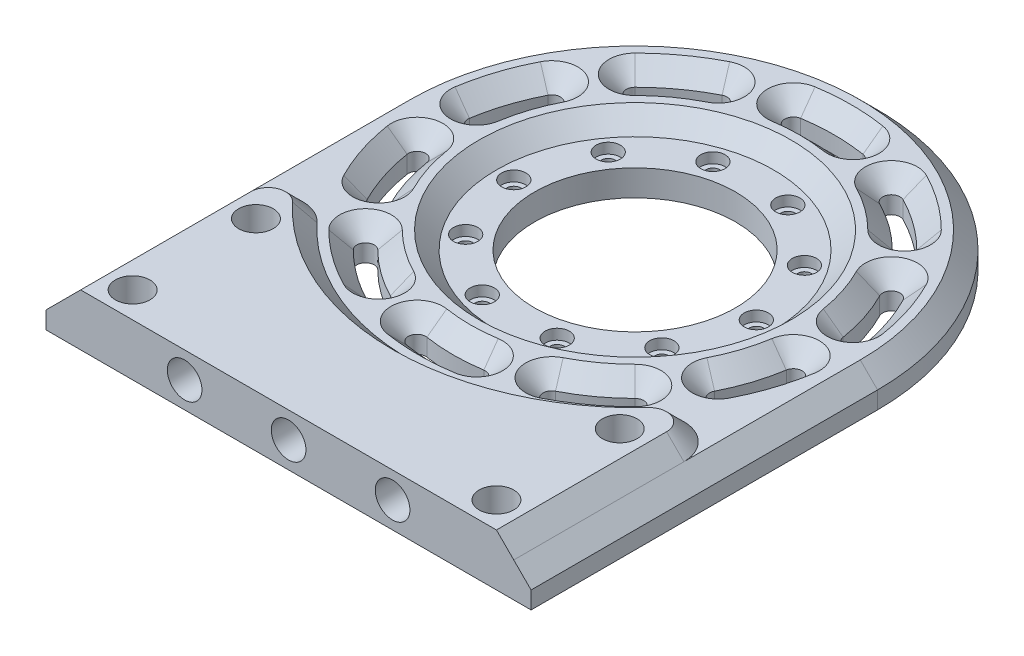
from build123d import *

# Parameters (mm, degrees)
SKETCH1_R           = 2
SKETCH1_R_2         = 29
BOSS_EXTRUDE2_DEPTH = 10
CUT_EXTRUDE5_START  = -5
SKETCH4_R           = 40
SKETCH4_R_2         = 29
CUT_EXTRUDE5_DEPTH  = 5
CHAMFER11_SIZE      = 5
CUT_EXTRUDE8_DEPTH  = 10
CHAMFER16_SIZE      = 5
BOSS_EXTRUDE3_DEPTH = 5
CUT_EXTRUDE9_DEPTH  = 10
CHAMFER18_SIZE      = 5
SKETCH12_R          = 3.5
CUT_EXTRUDE12_DEPTH = 3
BOSS_EXTRUDE4_START = 2.5
SKETCH13_R          = 45
SKETCH13_R_2        = 2
SKETCH13_R_3        = 29
BOSS_EXTRUDE4_DEPTH = 2.5
SKETCH14_R          = 5
CUT_EXTRUDE13_DEPTH = 10


with BuildPart() as part:
    # Sketch1 → Boss-Extrude2 (new body)
    with BuildSketch(Plane(origin=(0, 0, 0), x_dir=(1, 0, 0), z_dir=(0, 1, 0))):
        with BuildLine():
            Line((70, -100), (70, 0))
            ThreePointArc((70, 0), (0, 70), (-70, 0))
            Line((-70, 0), (-70, -100))
            Line((-70, -100), (70, -100))
        make_face()
        with Locations(Location((-28.315594803, 20.57248383, 0), (0, 0, 270))):
            Circle(SKETCH1_R, mode=Mode.SUBTRACT)
        with Locations(Location((-10.815594803, 33.28697807, 0), (0, 0, 270))):
            Circle(SKETCH1_R, mode=Mode.SUBTRACT)
        with Locations(Location((10.815594803, 33.28697807, 0), (0, 0, 270))):
            Circle(SKETCH1_R, mode=Mode.SUBTRACT)
        with Locations(Location((28.315594803, 20.57248383, 0), (0, 0, 270))):
            Circle(SKETCH1_R, mode=Mode.SUBTRACT)
        with Locations(Location((35, 0, 0), (0, 0, 270))):
            Circle(SKETCH1_R, mode=Mode.SUBTRACT)
        with Locations(Location((28.315594803, -20.57248383, 0), (0, 0, 270))):
            Circle(SKETCH1_R, mode=Mode.SUBTRACT)
        with Locations(Location((10.815594803, -33.28697807, 0), (0, 0, 270))):
            Circle(SKETCH1_R, mode=Mode.SUBTRACT)
        with Locations(Location((-10.815594803, -33.28697807, 0), (0, 0, 270))):
            Circle(SKETCH1_R, mode=Mode.SUBTRACT)
        with Locations(Location((-28.315594803, -20.57248383, 0), (0, 0, 270))):
            Circle(SKETCH1_R, mode=Mode.SUBTRACT)
        with Locations(Location((-35, 0, 0), (0, 0, 270))):
            Circle(SKETCH1_R, mode=Mode.SUBTRACT)
        with Locations(Location((0, 0, 0), (0, 0, 270))):
            Circle(SKETCH1_R_2, mode=Mode.SUBTRACT)
    extrude(amount=BOSS_EXTRUDE2_DEPTH)

    # Sketch4 → Cut-Extrude5 (cut)
    with BuildSketch(Plane(origin=(0, 10, 0), x_dir=(1, 0, 0), z_dir=(0, 1, 0)).offset(CUT_EXTRUDE5_START)):
        with Locations(Location((0, 0, 0), (0, 0, 270))):
            Circle(SKETCH4_R)
        with Locations(Location((0, 0, 0), (0, 0, 270))):
            Circle(SKETCH4_R_2, mode=Mode.SUBTRACT)
    extrude(amount=CUT_EXTRUDE5_DEPTH, mode=Mode.SUBTRACT)

    # Chamfer11
    chamfer11_edges = [part.edges().sort_by_distance(p)[0] for p in [
        (0, 10, -40),
        (0, 10, -70),
        (-70, 10, 50),
        (70, 10, 50),
    ]]
    chamfer(chamfer11_edges, length=CHAMFER11_SIZE - 0.0001)  # a hair under: the kernel refuses the full size

    # Sketch7 → Cut-Extrude8 (cut)
    with BuildSketch(Plane(origin=(0, 10, 0), x_dir=(1, 0, 0), z_dir=(0, 1, 0))):
        with BuildLine():
            ThreePointArc((-51.232875141, 26.104453735), (-54.685749687, 17.768477177), (-56.792079584, 8.99498174))
            ThreePointArc((-56.792079584, 8.99498174), (-54.713944895, 6.134674726), (-51.853637881, 8.212809415))
            ThreePointArc((-51.853637881, 8.212809415), (-49.930467105, 16.223392205), (-46.77784252, 23.834501236))
            ThreePointArc((-46.77784252, 23.834501236), (-47.870382581, 27.196993796), (-51.232875141, 26.104453735))
        make_face()
        with BuildLine():
            ThreePointArc((-26.104453735, 51.232875141), (-33.797652007, 46.518477177), (-40.658639918, 40.658639918))
            ThreePointArc((-40.658639918, 40.658639918), (-40.658639918, 37.123106012), (-37.123106012, 37.123106012))
            ThreePointArc((-37.123106012, 37.123106012), (-30.858725745, 42.473392205), (-23.834501236, 46.77784252))
            ThreePointArc((-23.834501236, 46.77784252), (-22.741961175, 50.14033508), (-26.104453735, 51.232875141))
        make_face()
        with BuildLine():
            ThreePointArc((8.99498174, 56.792079584), (0, 57.5), (-8.99498174, 56.792079584))
            ThreePointArc((-8.99498174, 56.792079584), (-11.073116429, 53.93177257), (-8.212809415, 51.853637881))
            ThreePointArc((-8.212809415, 51.853637881), (0, 52.5), (8.212809415, 51.853637881))
            ThreePointArc((8.212809415, 51.853637881), (11.073116429, 53.93177257), (8.99498174, 56.792079584))
        make_face()
        with BuildLine():
            ThreePointArc((40.658639918, 40.658639918), (33.797652007, 46.518477177), (26.104453735, 51.232875141))
            ThreePointArc((26.104453735, 51.232875141), (22.741961175, 50.14033508), (23.834501236, 46.77784252))
            ThreePointArc((23.834501236, 46.77784252), (30.858725745, 42.473392205), (37.123106012, 37.123106012))
            ThreePointArc((37.123106012, 37.123106012), (40.658639918, 37.123106012), (40.658639918, 40.658639918))
        make_face()
        with BuildLine():
            ThreePointArc((56.792079584, 8.99498174), (54.685749687, 17.768477177), (51.232875141, 26.104453735))
            ThreePointArc((51.232875141, 26.104453735), (47.870382581, 27.196993796), (46.77784252, 23.834501236))
            ThreePointArc((46.77784252, 23.834501236), (49.930467105, 16.223392205), (51.853637881, 8.212809415))
            ThreePointArc((51.853637881, 8.212809415), (54.713944895, 6.134674726), (56.792079584, 8.99498174))
        make_face()
        with BuildLine():
            ThreePointArc((51.232875141, -26.104453735), (54.685749687, -17.768477177), (56.792079584, -8.99498174))
            ThreePointArc((56.792079584, -8.99498174), (54.713944895, -6.134674726), (51.853637881, -8.212809415))
            ThreePointArc((51.853637881, -8.212809415), (49.930467105, -16.223392205), (46.77784252, -23.834501236))
            ThreePointArc((46.77784252, -23.834501236), (47.870382581, -27.196993796), (51.232875141, -26.104453735))
        make_face()
        with BuildLine():
            ThreePointArc((26.104453735, -51.232875141), (33.797652007, -46.518477177), (40.658639918, -40.658639918))
            ThreePointArc((40.658639918, -40.658639918), (40.658639918, -37.123106012), (37.123106012, -37.123106012))
            ThreePointArc((37.123106012, -37.123106012), (30.858725745, -42.473392205), (23.834501236, -46.77784252))
            ThreePointArc((23.834501236, -46.77784252), (22.741961175, -50.14033508), (26.104453735, -51.232875141))
        make_face()
        with BuildLine():
            ThreePointArc((-8.99498174, -56.792079584), (0, -57.5), (8.99498174, -56.792079584))
            ThreePointArc((8.99498174, -56.792079584), (11.073116429, -53.93177257), (8.212809415, -51.853637881))
            ThreePointArc((8.212809415, -51.853637881), (0, -52.5), (-8.212809415, -51.853637881))
            ThreePointArc((-8.212809415, -51.853637881), (-11.073116429, -53.93177257), (-8.99498174, -56.792079584))
        make_face()
        with BuildLine():
            ThreePointArc((-40.658639918, -40.658639918), (-33.797652007, -46.518477177), (-26.104453735, -51.232875141))
            ThreePointArc((-26.104453735, -51.232875141), (-22.741961175, -50.14033508), (-23.834501236, -46.77784252))
            ThreePointArc((-23.834501236, -46.77784252), (-30.858725745, -42.473392205), (-37.123106012, -37.123106012))
            ThreePointArc((-37.123106012, -37.123106012), (-40.658639918, -37.123106012), (-40.658639918, -40.658639918))
        make_face()
        with BuildLine():
            ThreePointArc((-56.792079584, -8.99498174), (-54.685749687, -17.768477177), (-51.232875141, -26.104453735))
            ThreePointArc((-51.232875141, -26.104453735), (-47.870382581, -27.196993796), (-46.77784252, -23.834501236))
            ThreePointArc((-46.77784252, -23.834501236), (-49.930467105, -16.223392205), (-51.853637881, -8.212809415))
            ThreePointArc((-51.853637881, -8.212809415), (-54.713944895, -6.134674726), (-56.792079584, -8.99498174))
        make_face()
    extrude(amount=-CUT_EXTRUDE8_DEPTH, mode=Mode.SUBTRACT)

    # Chamfer16
    chamfer16_edges = [part.edges().sort_by_distance(p)[0] for p in [
        (-49.930467105, 10, 16.223392205),
        (-54.713944895, 10, 6.134674726),
        (-54.685749687, 10, 17.768477177),
        (-47.870382581, 10, 27.196993796),
        (-30.858725745, 10, 42.473392205),
        (-40.658639918, 10, 37.123106012),
        (-33.797652007, 10, 46.518477177),
        (-22.741961175, 10, 50.14033508),
        (0, 10, 52.5),
        (-11.073116429, 10, 53.93177257),
        (0, 10, 57.5),
        (11.073116429, 10, 53.93177257),
        (30.858725745, 10, 42.473392205),
        (22.741961175, 10, 50.14033508),
        (33.797652007, 10, 46.518477177),
        (40.658639918, 10, 37.123106012),
        (49.930467105, 10, 16.223392205),
        (47.870382581, 10, 27.196993796),
        (54.685749687, 10, 17.768477177),
        (54.713944895, 10, 6.134674726),
        (49.930467105, 10, -16.223392205),
        (54.713944895, 10, -6.134674726),
        (54.685749687, 10, -17.768477177),
        (47.870382581, 10, -27.196993796),
        (30.858725745, 10, -42.473392205),
        (40.658639918, 10, -37.123106012),
        (33.797652007, 10, -46.518477177),
        (22.741961175, 10, -50.14033508),
        (0, 10, -52.5),
        (11.073116429, 10, -53.93177257),
        (0, 10, -57.5),
        (-11.073116429, 10, -53.93177257),
        (-49.930467105, 10, -16.223392205),
        (-47.870382581, 10, -27.196993796),
        (-54.685749687, 10, -17.768477177),
        (-54.713944895, 10, -6.134674726),
        (-30.858725745, 10, -42.473392205),
        (-22.741961175, 10, -50.14033508),
        (-33.797652007, 10, -46.518477177),
        (-40.658639918, 10, -37.123106012),
    ]]
    chamfer(chamfer16_edges, length=CHAMFER16_SIZE)

    # Sketch8 → Boss-Extrude3 (add)
    with BuildSketch(Plane(origin=(0, 10, 0), x_dir=(1, 0, 0), z_dir=(0, 1, 0))):
        with BuildLine():
            Line((-60, -50.893246483), (-60, -100))
            Line((-60, -100), (60, -100))
            Line((60, -100), (60, -50.893246483))
            ThreePointArc((60, -50.893246483), (56.825741858, -46.238499801), (51.333333333, -47.49390014))
            ThreePointArc((51.333333333, -47.49390014), (0, -69.903051347), (-51.333333333, -47.49390014))
            ThreePointArc((-51.333333333, -47.49390014), (-56.825741858, -46.238499801), (-60, -50.893246483))
        make_face()
    extrude(amount=BOSS_EXTRUDE3_DEPTH)

    # Sketch9 → Cut-Extrude9 (cut)
    with BuildSketch(Plane(origin=(0, 15, 0), x_dir=(1, 0, 0), z_dir=(0, 1, 0))):
        with BuildLine():
            ThreePointArc((-52.5, -56.911822602), (-50.633684973, -58.575702097), (-48.714667694, -60.178511955))
            ThreePointArc((-48.714667694, -60.178511955), (-47.813494824, -58.654426755), (-47.5, -56.911822602))
            ThreePointArc((-47.5, -56.911822602), (-56.035533906, -53.376288696), (-52.5, -61.911822602))
            Line((-52.5, -61.911822602), (-52.5, -56.911822602))
        make_face()
        with BuildLine():
            ThreePointArc((-52.5, -61.911822602), (-50.418347623, -61.457889405), (-48.714667694, -60.178511955))
            ThreePointArc((-48.714667694, -60.178511955), (-50.633684973, -58.575702097), (-52.5, -56.911822602))
            Line((-52.5, -56.911822602), (-52.5, -61.911822602))
        make_face()
        with BuildLine():
            ThreePointArc((-52.5, -56.911822602), (-50.633684973, -58.575702097), (-48.714667694, -60.178511955))
            ThreePointArc((-48.714667694, -60.178511955), (-47.813494824, -58.654426755), (-47.5, -56.911822602))
            ThreePointArc((-47.5, -56.911822602), (-56.035533906, -53.376288696), (-52.5, -61.911822602))
            Line((-52.5, -61.911822602), (-52.5, -56.911822602))
        make_face()
        with BuildLine():
            ThreePointArc((-52.5, -61.911822602), (-50.418347623, -61.457889405), (-48.714667694, -60.178511955))
            ThreePointArc((-48.714667694, -60.178511955), (-50.633684973, -58.575702097), (-52.5, -56.911822602))
            Line((-52.5, -56.911822602), (-52.5, -61.911822602))
        make_face()
        with BuildLine():
            ThreePointArc((-52.5, -87.5), (-56.035533906, -96.035533906), (-47.5, -92.5))
            Line((-47.5, -92.5), (-52.5, -92.5))
            Line((-52.5, -92.5), (-52.5, -87.5))
        make_face()
        with BuildLine():
            Line((-52.5, -92.5), (-47.5, -92.5))
            ThreePointArc((-47.5, -92.5), (-48.964466094, -88.964466094), (-52.5, -87.5))
            Line((-52.5, -87.5), (-52.5, -92.5))
        make_face()
        with BuildLine():
            ThreePointArc((-52.5, -87.5), (-56.035533906, -96.035533906), (-47.5, -92.5))
            Line((-47.5, -92.5), (-52.5, -92.5))
            Line((-52.5, -92.5), (-52.5, -87.5))
        make_face()
        with BuildLine():
            Line((-52.5, -92.5), (-47.5, -92.5))
            ThreePointArc((-47.5, -92.5), (-48.964466094, -88.964466094), (-52.5, -87.5))
            Line((-52.5, -87.5), (-52.5, -92.5))
        make_face()
        with BuildLine():
            ThreePointArc((57.5, -92.5), (56.035533906, -88.964466094), (52.5, -87.5))
            Line((52.5, -87.5), (52.5, -92.5))
            Line((52.5, -92.5), (47.5, -92.5))
            ThreePointArc((47.5, -92.5), (52.5, -97.5), (57.5, -92.5))
        make_face()
        with BuildLine():
            Line((52.5, -92.5), (52.5, -87.5))
            ThreePointArc((52.5, -87.5), (48.964466094, -88.964466094), (47.5, -92.5))
            Line((47.5, -92.5), (52.5, -92.5))
        make_face()
        with BuildLine():
            ThreePointArc((57.5, -92.5), (56.035533906, -88.964466094), (52.5, -87.5))
            Line((52.5, -87.5), (52.5, -92.5))
            Line((52.5, -92.5), (47.5, -92.5))
            ThreePointArc((47.5, -92.5), (52.5, -97.5), (57.5, -92.5))
        make_face()
        with BuildLine():
            Line((52.5, -92.5), (52.5, -87.5))
            ThreePointArc((52.5, -87.5), (48.964466094, -88.964466094), (47.5, -92.5))
            Line((47.5, -92.5), (52.5, -92.5))
        make_face()
        with BuildLine():
            ThreePointArc((48.714667694, -60.178511955), (50.633684973, -58.575702097), (52.5, -56.911822602))
            Line((52.5, -56.911822602), (52.5, -61.911822602))
            ThreePointArc((52.5, -61.911822602), (56.035533906, -60.447356508), (57.5, -56.911822602))
            ThreePointArc((57.5, -56.911822602), (50.757395847, -52.225317426), (48.714667694, -60.178511955))
        make_face()
        with BuildLine():
            Line((52.5, -61.911822602), (52.5, -56.911822602))
            ThreePointArc((52.5, -56.911822602), (50.633684973, -58.575702097), (48.714667694, -60.178511955))
            ThreePointArc((48.714667694, -60.178511955), (50.418347623, -61.457889405), (52.5, -61.911822602))
        make_face()
        with BuildLine():
            ThreePointArc((48.714667694, -60.178511955), (50.633684973, -58.575702097), (52.5, -56.911822602))
            Line((52.5, -56.911822602), (52.5, -61.911822602))
            ThreePointArc((52.5, -61.911822602), (56.035533906, -60.447356508), (57.5, -56.911822602))
            ThreePointArc((57.5, -56.911822602), (50.757395847, -52.225317426), (48.714667694, -60.178511955))
        make_face()
        with BuildLine():
            Line((52.5, -61.911822602), (52.5, -56.911822602))
            ThreePointArc((52.5, -56.911822602), (50.633684973, -58.575702097), (48.714667694, -60.178511955))
            ThreePointArc((48.714667694, -60.178511955), (50.418347623, -61.457889405), (52.5, -61.911822602))
        make_face()
    extrude(amount=-CUT_EXTRUDE9_DEPTH, mode=Mode.SUBTRACT)

    # Chamfer18
    chamfer18_edges = [part.edges().sort_by_distance(p)[0] for p in [
        (60, 10, 75.446623241),
        (56.825741858, 10, 46.238499801),
        (0, 10, 69.903051347),
        (-56.825741858, 10, 46.238499801),
        (-60, 10, 75.446623241),
    ]]
    chamfer(chamfer18_edges, length=CHAMFER18_SIZE - 0.0001)  # a hair under: the kernel refuses the full size

    # Sketch12 → Cut-Extrude12 (cut)
    with BuildSketch(Plane(origin=(0, 5, 0), x_dir=(1, 0, 0), z_dir=(0, 1, 0))):
        with Locations(Location((-35, 0, 0), (0, 0, 270))):
            Circle(SKETCH12_R)
        with Locations(Location((-28.315594803, 20.57248383, 0), (0, 0, 270))):
            Circle(SKETCH12_R)
        with Locations(Location((-10.815594803, 33.28697807, 0), (0, 0, 270))):
            Circle(SKETCH12_R)
        with Locations(Location((10.815594803, 33.28697807, 0), (0, 0, 270))):
            Circle(SKETCH12_R)
        with Locations(Location((28.315594803, 20.57248383, 0), (0, 0, 270))):
            Circle(SKETCH12_R)
        with Locations(Location((35, 0, 0), (0, 0, 270))):
            Circle(SKETCH12_R)
        with Locations(Location((28.315594803, -20.57248383, 0), (0, 0, 270))):
            Circle(SKETCH12_R)
        with Locations(Location((10.815594803, -33.28697807, 0), (0, 0, 270))):
            Circle(SKETCH12_R)
        with Locations(Location((-10.815594803, -33.28697807, 0), (0, 0, 270))):
            Circle(SKETCH12_R)
        with Locations(Location((-28.315594803, -20.57248383, 0), (0, 0, 270))):
            Circle(SKETCH12_R)
    extrude(amount=-CUT_EXTRUDE12_DEPTH, mode=Mode.SUBTRACT)

    # Sketch13 → Boss-Extrude4 (add)
    with BuildSketch(Plane.XZ.offset(BOSS_EXTRUDE4_START)):
        with Locations(Location((0, 0, 0), (0, 0, 90))):
            Circle(SKETCH13_R)
        with Locations(Location((-10.815594803, -33.28697807, 0), (0, 0, 270))):
            Circle(SKETCH13_R_2, mode=Mode.SUBTRACT)
        with Locations(Location((-28.315594803, -20.57248383, 0), (0, 0, 270))):
            Circle(SKETCH13_R_2, mode=Mode.SUBTRACT)
        with Locations(Location((10.815594803, -33.28697807, 0), (0, 0, 270))):
            Circle(SKETCH13_R_2, mode=Mode.SUBTRACT)
        with Locations(Location((28.315594803, -20.57248383, 0), (0, 0, 270))):
            Circle(SKETCH13_R_2, mode=Mode.SUBTRACT)
        with Locations(Location((-35, 0, 0), (0, 0, 270))):
            Circle(SKETCH13_R_2, mode=Mode.SUBTRACT)
        with Locations(Location((-28.315594803, 20.57248383, 0), (0, 0, 270))):
            Circle(SKETCH13_R_2, mode=Mode.SUBTRACT)
        with Locations(Location((-10.815594803, 33.28697807, 0), (0, 0, 270))):
            Circle(SKETCH13_R_2, mode=Mode.SUBTRACT)
        with Locations(Location((0, 0, 0), (0, 0, 270))):
            Circle(SKETCH13_R_3, mode=Mode.SUBTRACT)
        with Locations(Location((35, 0, 0), (0, 0, 270))):
            Circle(SKETCH13_R_2, mode=Mode.SUBTRACT)
        with Locations(Location((28.315594803, 20.57248383, 0), (0, 0, 270))):
            Circle(SKETCH13_R_2, mode=Mode.SUBTRACT)
        with Locations(Location((10.815594803, 33.28697807, 0), (0, 0, 270))):
            Circle(SKETCH13_R_2, mode=Mode.SUBTRACT)
    extrude(amount=-BOSS_EXTRUDE4_DEPTH)

    # Sketch14 → Cut-Extrude13 (cut)
    with BuildSketch(Plane.XY.offset(100)):
        with Locations((-29.992113345, 7.5)):
            Circle(SKETCH14_R)
        with Locations((0.015773309, 7.5)):
            Circle(SKETCH14_R)
        with Locations((30.023659964, 7.5)):
            Circle(SKETCH14_R)
    extrude(amount=-CUT_EXTRUDE13_DEPTH, mode=Mode.SUBTRACT)


solid = part.part
